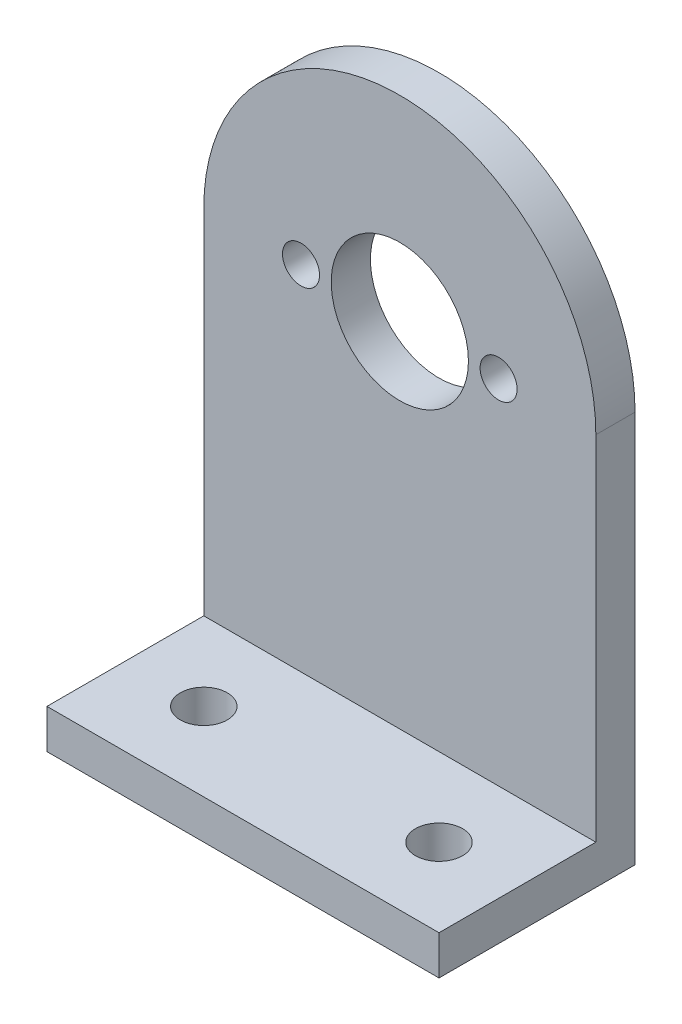
from build123d import *

# Parameters (mm, degrees)
SKETCH1_R             = 15.875
SKETCH1_W             = 31.75
SKETCH1_H             = 31.75
BOSS_EXTRUDE1_DEPTH   = 3.175
SKETCH3_R             = 5.55625
CUT_EXTRUDE1_DEPTH    = 36.639286609
SKETCH4_W             = 31.75
SKETCH4_H             = 3.175
BOSS_EXTRUDE2_DEPTH   = 12.7
SKETCH5_R             = 1.905
CUT_EXTRUDE2_DEPTH    = 50.797929174
F_3_0MM_DOWEL_HOLE1_D = 3
CHAMFER1_SIZE         = 0.762


with BuildPart() as part:
    # Sketch1 → Boss-Extrude1 (new body)
    with BuildSketch(Plane.XY):
        Circle(SKETCH1_R)
        with Locations((0, -15.875)):
            Rectangle(SKETCH1_W, SKETCH1_H)
    extrude(amount=BOSS_EXTRUDE1_DEPTH)

    # Sketch3 → Cut-Extrude1 (cut, through all)
    with BuildSketch(Plane.XY.offset(3.175)):
        Circle(SKETCH3_R)
    extrude(amount=-CUT_EXTRUDE1_DEPTH, mode=Mode.SUBTRACT)

    # Sketch4 → Boss-Extrude2 (add)
    with BuildSketch(Plane.XY.offset(3.175)):
        with Locations((0, -30.1625)):
            Rectangle(SKETCH4_W, SKETCH4_H)
    extrude(amount=BOSS_EXTRUDE2_DEPTH)

    # Sketch5 → Cut-Extrude2 (cut, through all)
    with BuildSketch(Plane(origin=(0, -28.575, 0), x_dir=(1, 0, 0), z_dir=(0, 1, 0))):
        with Locations((-9.525, -9.525)):
            Circle(SKETCH5_R)
        with Locations((9.525, -9.525)):
            Circle(SKETCH5_R)
    extrude(amount=-CUT_EXTRUDE2_DEPTH, mode=Mode.SUBTRACT)

    # Ø3.0mm Dowel Hole1 (through all)
    with Locations(Plane.XY.offset(3.175)):
        with Locations((-8.001, 0), (8.001, 0)):
            Hole(F_3_0MM_DOWEL_HOLE1_D / 2)

    # Chamfer1
    chamfer1_edges = [part.edges().sort_by_distance(p)[0] for p in [
        (-6.501, 0, 0),
        (9.501, 0, 0),
    ]]
    chamfer(chamfer1_edges, length=CHAMFER1_SIZE)


solid = part.part
